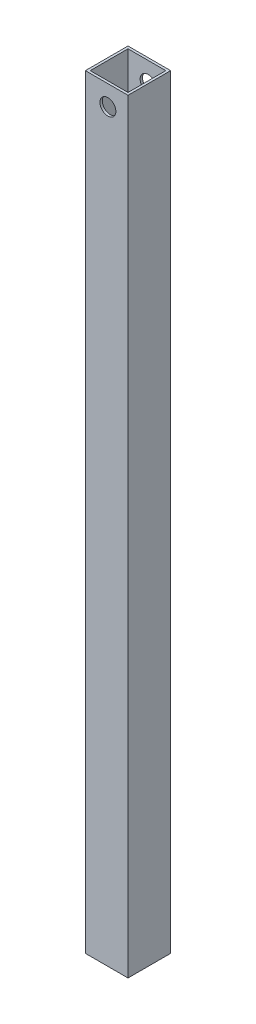
from build123d import *

# Parameters (mm, degrees)
SKETCH1_W           = 26.924
SKETCH1_H           = 26.924
SKETCH1_W_2         = 23.876
SKETCH1_H_2         = 23.876
EXTRUDE_THIN1_DEPTH = 482.6
SKETCH2_R           = 5.0419
CUT_EXTRUDE1_DEPTH  = 484.537886023


with BuildPart() as part:
    # Sketch1 → Extrude-Thin1 (new body)
    with BuildSketch(Plane(origin=(0, 0, 0), x_dir=(1, 0, 0), z_dir=(0, 1, 0))):
        Rectangle(SKETCH1_W, SKETCH1_H)
        Rectangle(SKETCH1_W_2, SKETCH1_H_2, mode=Mode.SUBTRACT)
    extrude(amount=EXTRUDE_THIN1_DEPTH)

    # Sketch2 → Cut-Extrude1 (cut, through all)
    with BuildSketch(Plane.XY.offset(13.462)):
        with Locations((0.762, 469.9)):
            Circle(SKETCH2_R)
    extrude(amount=-CUT_EXTRUDE1_DEPTH, mode=Mode.SUBTRACT)


solid = part.part
